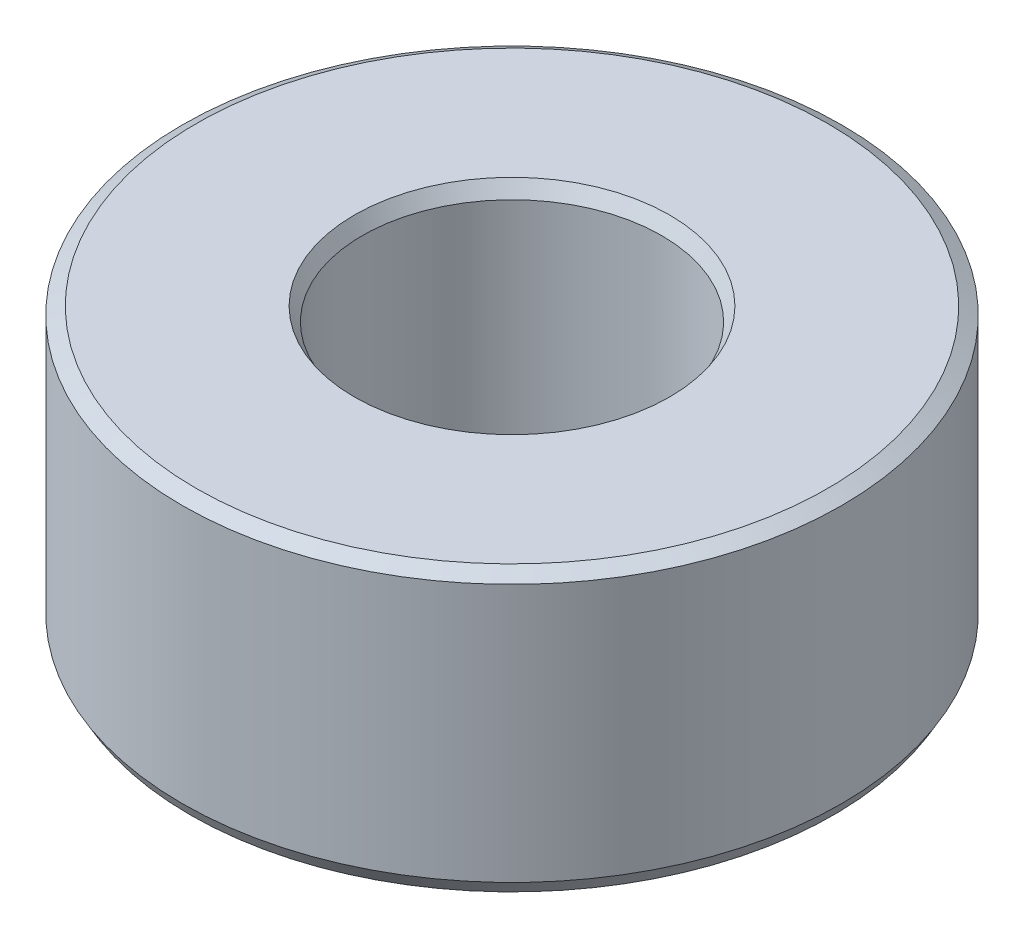
from build123d import *
from OCP.BRepFilletAPI import BRepFilletAPI_MakeChamfer

# Parameters (mm, degrees)
SKETCH1_R           = 45
BOSS_EXTRUDE1_DEPTH = 38.207300488
SKETCH2_R           = 20.428113203
CUT_EXTRUDE1_DEPTH  = 75.228012304
CHAMFER1_SIZE       = 1.088240338
CHAMFER1_SIZE2      = 1.884887556


with BuildPart() as part:
    # Sketch1 → Boss-Extrude1 (new body)
    with BuildSketch(Plane(origin=(0, 0, 0), x_dir=(1, 0, 0), z_dir=(0, 1, 0))):
        Circle(SKETCH1_R)
    extrude(amount=BOSS_EXTRUDE1_DEPTH)

    # Sketch2 → Cut-Extrude1 (cut, through all)
    with BuildSketch(Plane(origin=(0, 0, 0), x_dir=(1, 0, 0), z_dir=(0, 1, 0))):
        Circle(SKETCH2_R)
    extrude(amount=CUT_EXTRUDE1_DEPTH, mode=Mode.SUBTRACT)

    # Chamfer1: one chamfer whose edges measure the first distance from different faces: ONE call of the kernel's chamfer builder (chamfer() names one face for all edges)
    chamfer1_edges_1 = [part.edges().sort_by_distance(p)[0] for p in [
        (-20.428113203, 38.207300488, 0),
    ]]
    chamfer1_side_1 = [part.faces().sort_by_distance(p)[0] for p in [
        (-43.727207794, 38.207300488, 0),
    ]]
    chamfer1_edges_2 = [part.edges().sort_by_distance(p)[0] for p in [
        (-20.428113203, 0, 0),
    ]]
    chamfer1_side_2 = [part.faces().sort_by_distance(p)[0] for p in [
        (-20.428113203, 19.103650244, 0),
    ]]
    chamfer1_edges_3 = [part.edges().sort_by_distance(p)[0] for p in [
        (-45, 0, 0),
    ]]
    chamfer1_side_3 = [part.faces().sort_by_distance(p)[0] for p in [
        (-43.727207794, 0, 0),
    ]]
    chamfer1_edges_4 = [part.edges().sort_by_distance(p)[0] for p in [
        (-45, 38.207300488, 0),
    ]]
    chamfer1_side_4 = [part.faces().sort_by_distance(p)[0] for p in [
        (-45, 19.103650244, 0),
    ]]
    chamfer1 = BRepFilletAPI_MakeChamfer(part.part.solid().wrapped)
    for e in chamfer1_edges_1:
        chamfer1.Add(CHAMFER1_SIZE, CHAMFER1_SIZE2, e.wrapped, chamfer1_side_1[0].wrapped)  # the first distance lies on this face
    for e in chamfer1_edges_2:
        chamfer1.Add(CHAMFER1_SIZE, CHAMFER1_SIZE2, e.wrapped, chamfer1_side_2[0].wrapped)  # the first distance lies on this face
    for e in chamfer1_edges_3:
        chamfer1.Add(CHAMFER1_SIZE, CHAMFER1_SIZE2, e.wrapped, chamfer1_side_3[0].wrapped)  # the first distance lies on this face
    for e in chamfer1_edges_4:
        chamfer1.Add(CHAMFER1_SIZE, CHAMFER1_SIZE2, e.wrapped, chamfer1_side_4[0].wrapped)  # the first distance lies on this face
    add(Compound.cast(chamfer1.Shape()), mode=Mode.REPLACE)


solid = part.part
